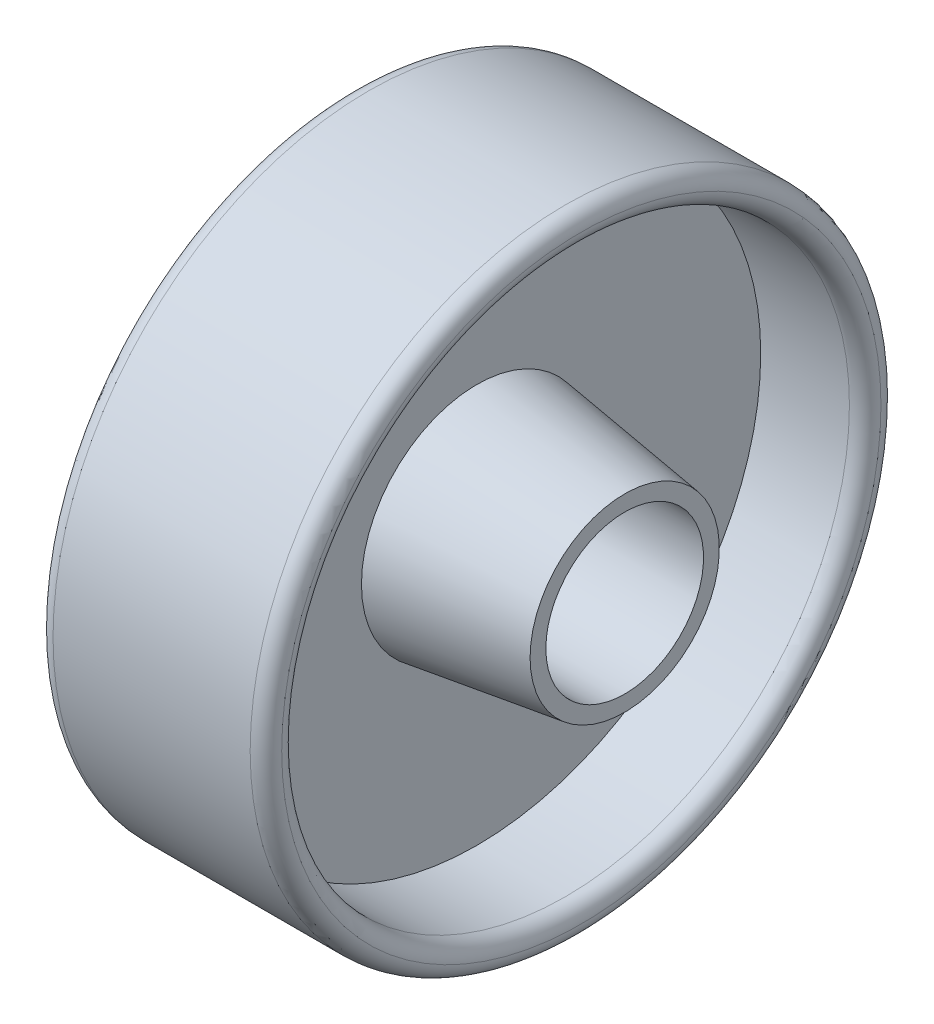
from build123d import *

# Parameters (mm, degrees)
FILLET1_R = 2


with BuildPart() as part:
    # Sketch2 → Revolve1 (revolve)
    with BuildSketch(Plane.XY, mode=Mode.PRIVATE) as revolve1_sk:
        Polygon((-20, 10), (20, 10), (20, 12), (1.25, 14.635140651), (1.25, 36), (14.5, 36), (14.5, 40), (-14.5, 40), (-14.5, 36), (-1.25, 36), (-1.25, 14.635140651), (-20, 12), align=None)
    revolve(revolve1_sk.sketch.rotate(Axis((0, 0, 0), (1, 0, 0)), 90), axis=Axis((0, 0, 0), (1, 0, 0)))

    # Fillet1
    fillet1_edges = [part.edges().sort_by_distance(p)[0] for p in [
        (14.5, 0, -40),
        (-14.5, 0, -40),
        (-14.5, 0, -36),
        (14.5, 0, -36),
    ]]
    fillet(fillet1_edges, radius=FILLET1_R - 0.0001)  # a hair under: the kernel refuses the full size


solid = part.part
